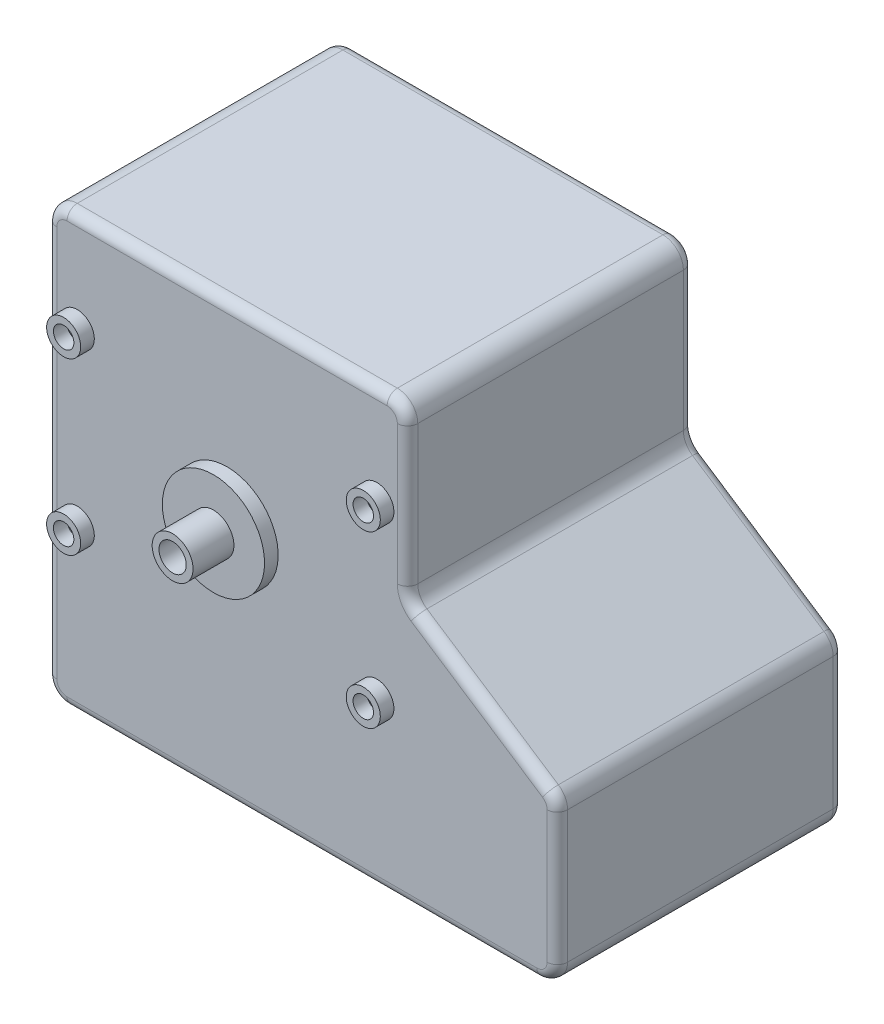
from build123d import *

# Parameters (mm, degrees)
BOSS_EXTRUDE1_DEPTH = 21
SKETCH3_R           = 2.5
SKETCH3_R_2         = 1.5
BOSS_EXTRUDE2_DEPTH = 2
SKETCH5_R           = 7.5
BOSS_EXTRUDE4_DEPTH = 2
FILLET1_R           = 3
FILLET2_R           = 1.5
SKETCH7_R           = 3
BOSS_EXTRUDE6_DEPTH = 6
SKETCH8_R           = 2
CUT_EXTRUDE2_DEPTH  = 77.552677941
BOSS_EXTRUDE7_DEPTH = 8


with BuildPart() as part:
    # Sketch2 → Boss-Extrude1 (new, symmetric)
    with BuildSketch(Plane.XY):
        Polygon((26.5, 6.75), (48.5, -7.75), (48.5, -31.75), (26.5, -31.75), (-26.5, -31.75), (-26.5, 31.75), (26.5, 31.75), align=None)
    extrude(amount=BOSS_EXTRUDE1_DEPTH, both=True)

    # Sketch3 → Boss-Extrude2 (add)
    # profile 1 of 4: a face of its own
    with BuildSketch(Plane.XY.offset(21)):
        with Locations((-22, 17.25)):
            Circle(SKETCH3_R)
        with Locations((-22, 17.25)):
            Circle(SKETCH3_R_2, mode=Mode.SUBTRACT)
    # profile 2 of 4: a face of its own
    with BuildSketch(Plane.XY.offset(21)):
        with Locations((22, 17.25)):
            Circle(SKETCH3_R)
        with Locations((22, 17.25)):
            Circle(SKETCH3_R_2, mode=Mode.SUBTRACT)
    # profile 3 of 4: a face of its own
    with BuildSketch(Plane.XY.offset(21)):
        with Locations((-22, -7.75)):
            Circle(SKETCH3_R)
        with Locations((-22, -7.75)):
            Circle(SKETCH3_R_2, mode=Mode.SUBTRACT)
    # profile 4 of 4: a face of its own
    with BuildSketch(Plane.XY.offset(21)):
        with Locations((22, -7.75)):
            Circle(SKETCH3_R)
        with Locations((22, -7.75)):
            Circle(SKETCH3_R_2, mode=Mode.SUBTRACT)
    extrude(amount=BOSS_EXTRUDE2_DEPTH)

    # Sketch5 → Boss-Extrude4 (add)
    with BuildSketch(Plane.XY.offset(21)):
        with Locations((0, 3.25)):
            Circle(SKETCH5_R)
    extrude(amount=BOSS_EXTRUDE4_DEPTH)

    # Fillet1
    fillet1_edges = [part.edges().sort_by_distance(p)[0] for p in [
        (-26.5, -31.75, 0),
        (-26.5, 31.75, 0),
        (48.5, -31.75, 0),
        (48.5, -7.75, 0),
        (26.5, 6.75, 0),
        (26.5, 31.75, 0),
    ]]
    fillet(fillet1_edges, radius=FILLET1_R)

    # Fillet2
    fillet2_edges = [part.edges().sort_by_distance(p)[0] for p in [
        (26.858710518, 6.943192097, -21),
        (37.5, -0.5, -21),
        (48.141289482, -7.943192097, -21),
        (48.5, -19.057860744, -21),
        (47.621320344, -30.871320344, -21),
        (11, -31.75, -21),
        (-25.621320344, -30.871320344, -21),
        (-26.5, 0, -21),
        (-25.621320344, 30.871320344, -21),
        (0, 31.75, -21),
        (25.621320344, 30.871320344, -21),
        (25.621320344, 30.871320344, 21),
        (26.5, 18.557860744, 21),
        (26.858710518, 6.943192097, 21),
        (37.5, -0.5, 21),
        (48.141289482, -7.943192097, 21),
        (48.5, -19.057860744, 21),
        (47.621320344, -30.871320344, 21),
        (11, -31.75, 21),
        (-25.621320344, -30.871320344, 21),
        (-26.5, 0, 21),
        (-25.621320344, 30.871320344, 21),
        (26.5, 18.557860744, -21),
        (0, 31.75, 21),
    ]]
    fillet(fillet2_edges, radius=FILLET2_R)

    # Sketch7 → Boss-Extrude6 (add)
    with BuildSketch(Plane.XY.offset(23)):
        with Locations((0, 3.25)):
            Circle(SKETCH7_R)
    extrude(amount=BOSS_EXTRUDE6_DEPTH)

    # Sketch8 → Cut-Extrude2 (cut, through all)
    with BuildSketch(Plane.XY.offset(29)):
        with Locations((0, 3.25)):
            Circle(SKETCH8_R)
    extrude(amount=-CUT_EXTRUDE2_DEPTH, mode=Mode.SUBTRACT)

    # Sketch9 → Boss-Extrude7 (add)
    with BuildSketch(Plane(origin=(0, 0, -21), x_dir=(-1, 0, 0), z_dir=(0, 0, -1))):
        with BuildLine():
            Line((-7.5, -9.25), (7.5, -9.25))
            ThreePointArc((7.5, -9.25), (11.035533906, -7.785533906), (12.5, -4.25))
            Line((12.5, -4.25), (12.5, 10.75))
            ThreePointArc((12.5, 10.75), (11.035533906, 14.285533906), (7.5, 15.75))
            Line((7.5, 15.75), (-7.5, 15.75))
            ThreePointArc((-7.5, 15.75), (-11.035533906, 14.285533906), (-12.5, 10.75))
            Line((-12.5, 10.75), (-12.5, -4.25))
            ThreePointArc((-12.5, -4.25), (-11.035533906, -7.785533906), (-7.5, -9.25))
        make_face()
    extrude(amount=BOSS_EXTRUDE7_DEPTH)


solid = part.part
